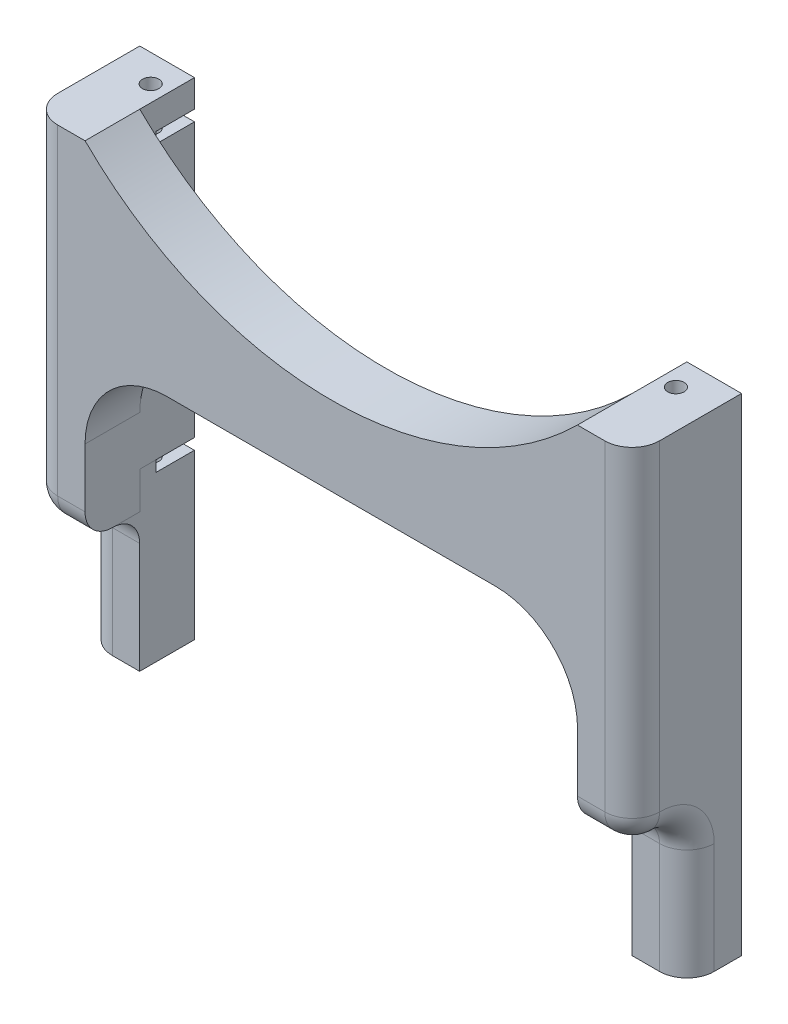
from build123d import *

# Parameters (mm, degrees)
BOSS_EXTRUDE1_DEPTH     = 10
CUT_EXTRUDE1_DEPTH      = 72.414284285
CUT_EXTRUDE1_DEPTH_BACK = 72.414284285
SKETCH2_R               = 1.5
SKETCH9_W               = 10
SKETCH9_H               = 50
BOSS_EXTRUDE9_DEPTH     = 5
SKETCH10_W              = 10
SKETCH10_H              = 50
BOSS_EXTRUDE10_DEPTH    = 5
BOSS_EXTRUDE11_DEPTH    = 2
SKETCH12_W              = 10
SKETCH12_H              = 10
BOSS_EXTRUDE12_DEPTH    = 5
CUT_EXTRUDE2_START      = 7
SKETCH13_R              = 1.5
CUT_EXTRUDE2_DEPTH      = 7
BOSS_EXTRUDE13_DEPTH    = 2
SKETCH15_W              = 9.981523119
SKETCH15_H              = 10
BOSS_EXTRUDE14_DEPTH    = 30
SKETCH16_R              = 1.5
CUT_EXTRUDE3_DEPTH      = 32
SKETCH17_W              = 110
SKETCH17_H              = 63.73964009
BOSS_EXTRUDE15_DEPTH    = 10
CUT_EXTRUDE4_REACH      = 83.695
SKETCH18_W              = 100.013857661
SKETCH18_H              = 2
SKETCH19_W              = 90.018476881
SKETCH19_H              = 50
CUT_EXTRUDE5_DEPTH      = 10
CUT_EXTRUDE6_DEPTH      = 80.837334625
SKETCH21_W              = 90.018476881
SKETCH21_H              = 30.73964009
CUT_EXTRUDE7_DEPTH      = 80.837334625
FILLET1_R               = 5
FILLET2_R               = 15
FILLET3_R               = 5


with BuildPart() as part:
    # Sketch1 → Boss-Extrude1 (new body)
    with BuildSketch(Plane.XY):
        with BuildLine():
            Line((45.018476881, -25), (50, -25))
            Line((50, -25), (50, 25))
            Line((50, 25), (45, 25))
            ThreePointArc((45, 25), (0, 8), (-45, 25))
            Line((-45, 25), (-50, 25))
            Line((-50, 25), (-50, -25))
            Line((-50, -25), (-45.018476881, -25))
            ThreePointArc((-45.018476881, -25), (0, -8), (45.018476881, -25))
        make_face()
    extrude(amount=BOSS_EXTRUDE1_DEPTH)

    # Sketch2 → Cut-Extrude1 (cut, two sides: drawn at the far end of the back side and taken through both)
    with BuildSketch(Plane(origin=(0, 25, 0), x_dir=(1, 0, 0), z_dir=(0, 1, 0)).offset(-CUT_EXTRUDE1_DEPTH_BACK)):
        with Locations(Location((-48, -5, 0), (0, 0, 180))):
            Circle(SKETCH2_R)
        with Locations(Location((48, -5, 0), (0, 0, 180))):
            Circle(SKETCH2_R)
    extrude(amount=CUT_EXTRUDE1_DEPTH + CUT_EXTRUDE1_DEPTH_BACK, mode=Mode.SUBTRACT)

    # Sketch9 → Boss-Extrude9 (add)
    with BuildSketch(Plane(origin=(50, 0, 0), x_dir=(0, 0, -1), z_dir=(1, 0, 0))):
        with Locations((-5, 0)):
            Rectangle(SKETCH9_W, SKETCH9_H)
    extrude(amount=BOSS_EXTRUDE9_DEPTH)

    # Sketch10 → Boss-Extrude10 (add)
    with BuildSketch(Plane.ZY.offset(50)):
        with Locations((5, 0)):
            Rectangle(SKETCH10_W, SKETCH10_H)
    extrude(amount=BOSS_EXTRUDE10_DEPTH)

    # Sketch11 → Boss-Extrude11 (add)
    with BuildSketch(Plane(origin=(0, 25, 0), x_dir=(1, 0, 0), z_dir=(0, 1, 0))):
        Polygon((50, 0), (50, -7), (45, -7), (45, -10), (55, -10), (55, 0), align=None)
        Polygon((-50, 0), (-50, -7), (-45, -7), (-45, -10), (-55, -10), (-55, 0), align=None)
    extrude(amount=BOSS_EXTRUDE11_DEPTH)

    # Sketch12 → Boss-Extrude12 (add)
    with BuildSketch(Plane(origin=(0, 27, 0), x_dir=(1, 0, 0), z_dir=(0, 1, 0))):
        with Locations((50, -5)):
            Rectangle(SKETCH12_W, SKETCH12_H)
        with Locations((-50, -5)):
            Rectangle(SKETCH12_W, SKETCH12_H)
    extrude(amount=BOSS_EXTRUDE12_DEPTH)

    # Sketch13 → Cut-Extrude2 (cut)
    with BuildSketch(Plane(origin=(0, 25, 0), x_dir=(1, 0, 0), z_dir=(0, 1, 0)).offset(CUT_EXTRUDE2_START)):
        with Locations(Location((48, -5, 0), (0, 0, 180))):
            Circle(SKETCH13_R)
        with Locations(Location((-48, -5, 0), (0, 0, 180))):
            Circle(SKETCH13_R)
    extrude(amount=-CUT_EXTRUDE2_DEPTH, mode=Mode.SUBTRACT)

    # Sketch14 → Boss-Extrude13 (add)
    with BuildSketch(Plane.XZ.offset(25)):
        Polygon((50.009238441, 0), (50.009238441, 7), (45.018476881, 7), (45.018476881, 10), (55, 10), (55, 0), align=None)
        Polygon((-50.009238441, 0), (-50.009238441, 7), (-45.018476881, 7), (-45.018476881, 10), (-55, 10), (-55, 0), align=None)
    extrude(amount=BOSS_EXTRUDE13_DEPTH)

    # Sketch15 → Boss-Extrude14 (add)
    with BuildSketch(Plane.XZ.offset(27)):
        with Locations((-50.00923844, 5)):
            Rectangle(SKETCH15_W, SKETCH15_H)
        with Locations((50.00923844, 5)):
            Rectangle(SKETCH15_W, SKETCH15_H)
    extrude(amount=BOSS_EXTRUDE14_DEPTH)

    # Sketch16 → Cut-Extrude3 (cut)
    with BuildSketch(Plane.XZ.offset(25)):
        with Locations(Location((48, 5, 0), (0, 0, 180))):
            Circle(SKETCH16_R)
        with Locations(Location((-48, 5, 0), (0, 0, 180))):
            Circle(SKETCH16_R)
    extrude(amount=CUT_EXTRUDE3_DEPTH, mode=Mode.SUBTRACT)

    # Sketch17 → Boss-Extrude15 (add)
    with BuildSketch(Plane.XY.offset(10)):
        with Locations((0, 0.130179955)):
            Rectangle(SKETCH17_W, SKETCH17_H)
    extrude(amount=BOSS_EXTRUDE15_DEPTH)

    # Cut-Extrude4: up to this face of the body (flat: up to its plane)
    cut_extrude4_end = Plane(part.part.faces().sort_by_distance((47.5, 26, 7))[0])
    # Sketch18 → Cut-Extrude4 (cut, up to the picked face)
    with BuildSketch(Plane(origin=(0, 0, 0), x_dir=(-1, 0, 0), z_dir=(0, 0, -1)), mode=Mode.PRIVATE) as cut_extrude4_sk1:
        with Locations((-0.00230961, 0)):
            Rectangle(SKETCH18_W, SKETCH18_H)
    cut_extrude4_tool1 = split(extrude(cut_extrude4_sk1.sketch, amount=-CUT_EXTRUDE4_REACH, mode=Mode.PRIVATE), bisect_by=cut_extrude4_end, keep=Keep.BOTH, mode=Mode.PRIVATE)
    add(cut_extrude4_tool1.solids().sort_by(Axis((0.00231, 0, 0), (0, 0, 1)))[0], mode=Mode.SUBTRACT)

    # Sketch19 → Cut-Extrude5 (cut)
    with BuildSketch(Plane(origin=(0, 0, 0), x_dir=(-1, 0, 0), z_dir=(0, 0, -1))):
        with Locations((-0.009238441, 0)):
            Rectangle(SKETCH19_W, SKETCH19_H)
    extrude(amount=-CUT_EXTRUDE5_DEPTH, mode=Mode.SUBTRACT)

    # Sketch20 → Cut-Extrude6 (cut, through all)
    with BuildSketch(Plane(origin=(0, 0, 10), x_dir=(-1, 0, 0), z_dir=(0, 0, -1))):
        with BuildLine():
            Line((-45, 32), (45, 32))
            ThreePointArc((45, 32), (0, 13.452072887), (-45, 32))
        make_face()
    extrude(amount=-CUT_EXTRUDE6_DEPTH, mode=Mode.SUBTRACT)

    # Sketch21 → Cut-Extrude7 (cut, through all)
    with BuildSketch(Plane(origin=(0, 0, 10), x_dir=(-1, 0, 0), z_dir=(0, 0, -1))):
        with Locations((-0.009238441, -16.369820045)):
            Rectangle(SKETCH21_W, SKETCH21_H)
    extrude(amount=-CUT_EXTRUDE7_DEPTH, mode=Mode.SUBTRACT)

    # Fillet1
    fillet1_edges = [part.edges().sort_by_distance(p)[0] for p in [
        (50.009238441, -31.73964009, 20),
        (50.009238441, -31.73964009, 10),
        (-50, -31.73964009, 20),
        (-50.009238441, -31.73964009, 10),
    ]]
    fillet(fillet1_edges, radius=FILLET1_R - 0.0001)  # a hair under: the kernel refuses the full size

    # Fillet2
    fillet2_edges = [part.edges().sort_by_distance(p)[0] for p in [
        (45.018476881, -1, 15),
        (-45, -1, 15),
    ]]
    fillet(fillet2_edges, radius=FILLET2_R)

    # Fillet3
    fillet3_edges = [part.edges().sort_by_distance(p)[0] for p in [
        (-55, 2.630129955, 20),
        (55, 2.630129955, 20),
        (55, -46.869770045, 10),
        (55, -30.275203285, 18.535563195),
        (-55, -30.275203285, 18.535563195),
        (55, -33.204076895, 11.464436805),
        (-55, -33.204076895, 11.464436805),
        (-55, -46.869770045, 10),
    ]]
    fillet(fillet3_edges, radius=FILLET3_R - 0.0001)  # a hair under: the kernel refuses the full size


solid = part.part
